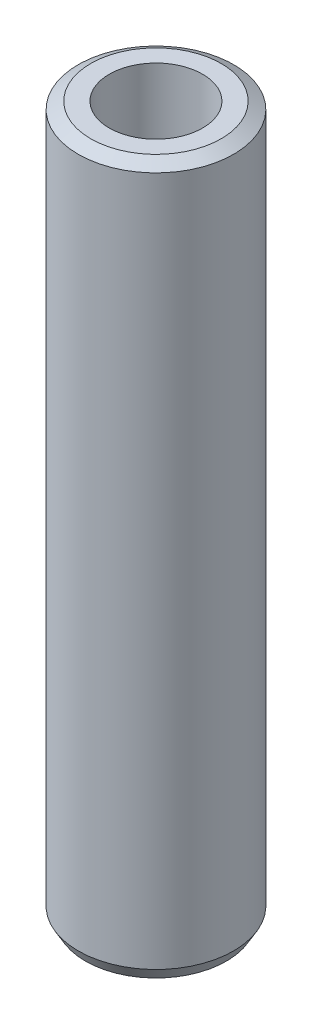
from build123d import *
from OCP.BRepFilletAPI import BRepFilletAPI_MakeChamfer

# Parameters (mm, degrees)
SKETCH1_R           = 10
BOSS_EXTRUDE1_DEPTH = 91.301410485
SKETCH2_R           = 6.006864005
CUT_EXTRUDE1_DEPTH  = 93.390191885
CHAMFER1_SIZE       = 0.927968654
CHAMFER1_SIZE2      = 1.607288856


with BuildPart() as part:
    # Sketch1 → Boss-Extrude1 (new body)
    with BuildSketch(Plane(origin=(0, 0, 0), x_dir=(1, 0, 0), z_dir=(0, 1, 0))):
        Circle(SKETCH1_R)
    extrude(amount=BOSS_EXTRUDE1_DEPTH)

    # Sketch2 → Cut-Extrude1 (cut, through all)
    with BuildSketch(Plane(origin=(0, 0, 0), x_dir=(1, 0, 0), z_dir=(0, 1, 0))):
        Circle(SKETCH2_R)
    extrude(amount=CUT_EXTRUDE1_DEPTH, mode=Mode.SUBTRACT)

    # Chamfer1: one chamfer whose edges measure the first distance from different faces: ONE call of the kernel's chamfer builder (chamfer() names one face for all edges)
    chamfer1_edges_1 = [part.edges().sort_by_distance(p)[0] for p in [
        (-10, 91.301410485, 0),
    ]]
    chamfer1_side_1 = [part.faces().sort_by_distance(p)[0] for p in [
        (-10, 45.650705243, 0),
    ]]
    chamfer1_edges_2 = [part.edges().sort_by_distance(p)[0] for p in [
        (-10, 0, 0),
    ]]
    chamfer1_side_2 = [part.faces().sort_by_distance(p)[0] for p in [
        (-9.717157288, 0, 0),
    ]]
    chamfer1 = BRepFilletAPI_MakeChamfer(part.part.solid().wrapped)
    for e in chamfer1_edges_1:
        chamfer1.Add(CHAMFER1_SIZE, CHAMFER1_SIZE2, e.wrapped, chamfer1_side_1[0].wrapped)  # the first distance lies on this face
    for e in chamfer1_edges_2:
        chamfer1.Add(CHAMFER1_SIZE, CHAMFER1_SIZE2, e.wrapped, chamfer1_side_2[0].wrapped)  # the first distance lies on this face
    add(Compound.cast(chamfer1.Shape()), mode=Mode.REPLACE)


solid = part.part
